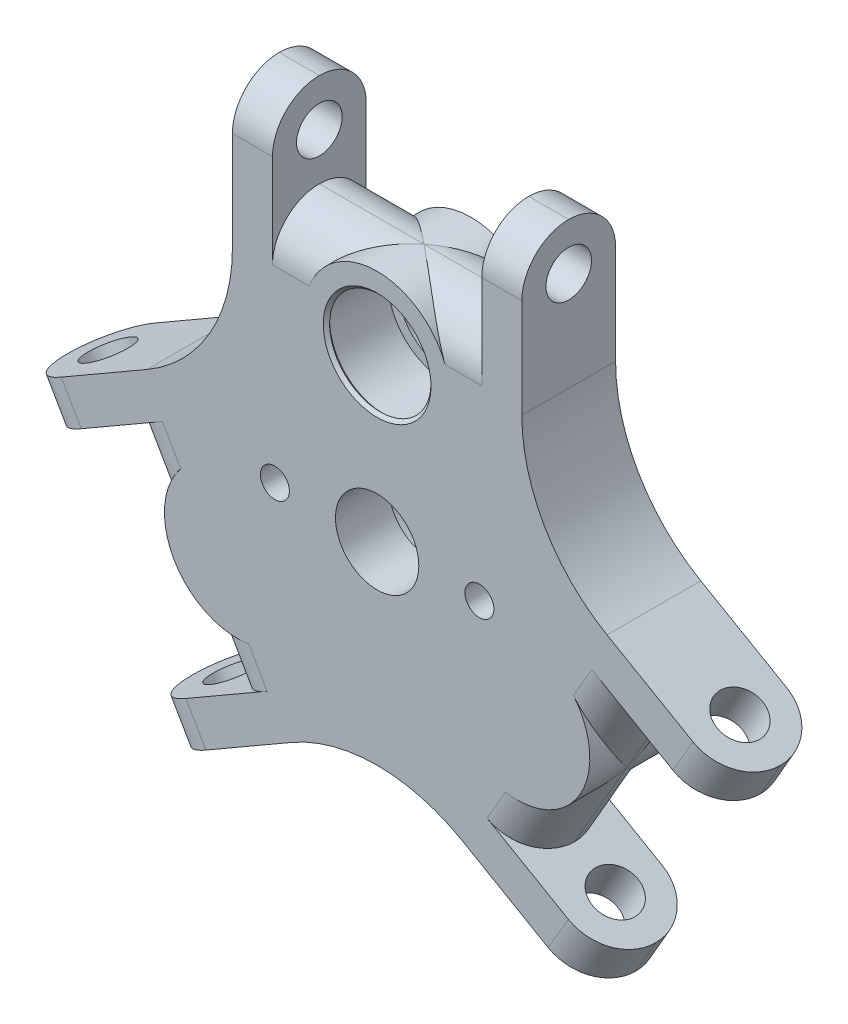
from build123d import *

# Parameters (mm, degrees)
SKETCH1_R           = 8.15
BOSS_EXTRUDE1_DEPTH = 11
FILLET1_R           = 5.5
SKETCH5_R           = 8.534526782
BOSS_EXTRUDE2_DEPTH = 11
SKETCH6_R           = 8.534526782
BOSS_EXTRUDE3_DEPTH = 11
SKETCH7_R           = 8.534526782
BOSS_EXTRUDE4_DEPTH = 11
SKETCH8_R           = 1.7
CUT_EXTRUDE4_DEPTH  = 58.906789501
BOSS_EXTRUDE5_START = -6.25
SKETCH12_R          = 8.15
BOSS_EXTRUDE5_DEPTH = 6.25
SKETCH14_R          = 4.8895
CUT_EXTRUDE7_DEPTH  = 58.906789501
SKETCH15_R          = 6.7
CUT_EXTRUDE8_DEPTH  = 8
SKETCH16_R          = 5.5
CUT_EXTRUDE9_DEPTH  = 58.412509697
SKETCH18_R          = 6.7
SKETCH18_R_2        = 5.95
BOSS_EXTRUDE6_DEPTH = 0.75
CHAMFER1_SIZE       = 0.375
CHAMFER2_SIZE       = 0.375
FILLET2_R           = 5.5
SKETCH19_R          = 2.675
CUT_EXTRUDE10_DEPTH = 72.149372656
SKETCH20_R          = 2.675
CUT_EXTRUDE11_DEPTH = 71.861300583
SKETCH21_R          = 2.675
CUT_EXTRUDE12_DEPTH = 75.055602664


with BuildPart() as part:
    # Sketch1 → Boss-Extrude1 (new body)
    with BuildSketch(Plane.XY):
        with BuildLine():
            Line((-16.980762114, 38.5), (-12.280762114, 38.5))
            Line((-12.280762114, 38.5), (-12.280762114, 27.5))
            Line((-12.280762114, 27.5), (12.280762114, 27.5))
            Line((12.280762114, 27.5), (12.280762114, 38.5))
            Line((12.280762114, 38.5), (16.980762114, 38.5))
            Line((16.980762114, 38.5), (16.980762114, 21.350852961))
            ThreePointArc((16.980762114, 21.350852961), (19.660254038, 11.350852961), (26.980762114, 4.030344885))
            Line((26.980762114, 4.030344885), (41.832359102, -4.544228634))
            Line((41.832359102, -4.544228634), (39.482359102, -8.614548032))
            Line((39.482359102, -8.614548032), (29.956079661, -3.114548032))
            Line((29.956079661, -3.114548032), (17.675317547, -24.385451968))
            Line((17.675317547, -24.385451968), (27.201596989, -29.885451968))
            Line((27.201596989, -29.885451968), (24.851596989, -33.955771366))
            Line((24.851596989, -33.955771366), (10, -25.381197846))
            ThreePointArc((10, -25.381197846), (0, -22.701705922), (-10, -25.381197846))
            Line((-10, -25.381197846), (-24.851596989, -33.955771366))
            Line((-24.851596989, -33.955771366), (-27.201596989, -29.885451968))
            Line((-27.201596989, -29.885451968), (-17.675317547, -24.385451968))
            Line((-17.675317547, -24.385451968), (-29.956079661, -3.114548032))
            Line((-29.956079661, -3.114548032), (-39.482359102, -8.614548032))
            Line((-39.482359102, -8.614548032), (-41.832359102, -4.544228634))
            Line((-41.832359102, -4.544228634), (-26.980762114, 4.030344885))
            ThreePointArc((-26.980762114, 4.030344885), (-19.660254038, 11.350852961), (-16.980762114, 21.350852961))
            Line((-16.980762114, 21.350852961), (-16.980762114, 38.5))
        make_face()
        Circle(SKETCH1_R, mode=Mode.SUBTRACT)
    extrude(amount=BOSS_EXTRUDE1_DEPTH)

    # Fillet1
    fillet1_edges = [part.edges().sort_by_distance(p)[0] for p in [
        (-23.815698604, -13.75, 0),
        (23.815698604, -13.75, 0),
        (23.815698604, -13.75, 11),
        (-23.815698604, -13.75, 11),
        (0, 27.5, 0),
        (0, 27.5, 11),
    ]]
    fillet(fillet1_edges, radius=FILLET1_R - 0.0001)  # a hair under: the kernel refuses the full size

    # Sketch5 → Boss-Extrude2 (add)
    with BuildSketch(Plane(origin=(0, 0, 0), x_dir=(-1, 0, 0), z_dir=(0, 0, -1))):
        with Locations((0, 18.965473218)):
            Circle(SKETCH5_R)
    extrude(amount=-BOSS_EXTRUDE2_DEPTH)

    # Sketch6 → Boss-Extrude3 (add)
    with BuildSketch(Plane(origin=(0, 0, 0), x_dir=(-1, 0, 0), z_dir=(0, 0, -1))):
        with Locations((-16.424581602, -9.482736609)):
            Circle(SKETCH6_R)
    extrude(amount=-BOSS_EXTRUDE3_DEPTH)

    # Sketch7 → Boss-Extrude4 (add)
    with BuildSketch(Plane.XY.offset(11)):
        with Locations((-16.424581602, -9.482736609)):
            Circle(SKETCH7_R)
    extrude(amount=-BOSS_EXTRUDE4_DEPTH)

    # Sketch8 → Cut-Extrude4 (cut, through all)
    with BuildSketch(Plane.XY.offset(11)):
        with Locations((-12, 0)):
            Circle(SKETCH8_R)
        with Locations((12, 0)):
            Circle(SKETCH8_R)
    extrude(amount=-CUT_EXTRUDE4_DEPTH, mode=Mode.SUBTRACT)

    # Sketch12 → Boss-Extrude5 (add)
    with BuildSketch(Plane.XY.offset(11).offset(BOSS_EXTRUDE5_START)):
        Circle(SKETCH12_R)
    extrude(amount=BOSS_EXTRUDE5_DEPTH)

    # Sketch14 → Cut-Extrude7 (cut, through all)
    with BuildSketch(Plane.XY.offset(11)):
        Circle(SKETCH14_R)
    extrude(amount=-CUT_EXTRUDE7_DEPTH, mode=Mode.SUBTRACT)

    # Sketch15 → Cut-Extrude8 (cut)
    with BuildSketch(Plane.XY.offset(11)):
        with Locations((0, 18.965473218)):
            Circle(SKETCH15_R)
    extrude(amount=-CUT_EXTRUDE8_DEPTH, mode=Mode.SUBTRACT)

    # Sketch16 → Cut-Extrude9 (cut, through all)
    with BuildSketch(Plane.XY.offset(3)):
        with Locations((0, 18.965473218)):
            Circle(SKETCH16_R)
    extrude(amount=-CUT_EXTRUDE9_DEPTH, mode=Mode.SUBTRACT)

    # Sketch18 → Boss-Extrude6 (add)
    with BuildSketch(Plane.XY.offset(11)):
        with Locations((0, 18.965473218)):
            Circle(SKETCH18_R)
        with Locations((0, 18.965473218)):
            Circle(SKETCH18_R_2, mode=Mode.SUBTRACT)
    extrude(amount=-BOSS_EXTRUDE6_DEPTH)

    # Chamfer1
    chamfer1_edges = [part.edges().sort_by_distance(p)[0] for p in [
        (-5.95, 18.965473218, 11),
    ]]
    chamfer(chamfer1_edges, length=CHAMFER1_SIZE)

    # Chamfer2
    chamfer2_edges = [part.edges().sort_by_distance(p)[0] for p in [
        (-5.95, 18.965473218, 10.25),
    ]]
    chamfer(chamfer2_edges, length=CHAMFER2_SIZE - 0.0001)  # a hair under: the kernel refuses the full size

    # Fillet2
    fillet2_edges = [part.edges().sort_by_distance(p)[0] for p in [
        (26.026596989, -31.920611667, 0),
        (40.657359102, -6.579388333, 0),
        (26.026596989, -31.920611667, 11),
        (40.657359102, -6.579388333, 11),
        (14.630762114, 38.5, 0),
        (14.630762114, 38.5, 11),
        (-40.657359102, -6.579388333, 0),
        (-40.657359102, -6.579388333, 11),
        (-26.026596989, -31.920611667, 0),
        (-26.026596989, -31.920611667, 11),
        (-14.630762114, 38.5, 0),
        (-14.630762114, 38.5, 11),
    ]]
    fillet(fillet2_edges, radius=FILLET2_R - 0.0001)  # a hair under: the kernel refuses the full size

    # Sketch19 → Cut-Extrude10 (cut, through all)
    with BuildSketch(Plane.ZY.offset(16.980762114)):
        with Locations(Location((5.5, 33, 0), (0, 0, 270))):
            Circle(SKETCH19_R)
    extrude(amount=-CUT_EXTRUDE10_DEPTH, mode=Mode.SUBTRACT)

    # Sketch20 → Cut-Extrude11 (cut, through all)
    with BuildSketch(Plane(origin=(-8.490381057, 14.705771366, 0), x_dir=(0.8660254037844307, 0.5000000000000139, 0), z_dir=(-0.5000000000000139, 0.8660254037844307, 0))):
        with Locations((-33, -5.5)):
            Circle(SKETCH20_R)
    extrude(amount=-CUT_EXTRUDE11_DEPTH, mode=Mode.SUBTRACT)

    # Sketch21 → Cut-Extrude12 (cut, through all)
    with BuildSketch(Plane(origin=(-8.490381057, -14.705771366, 0), x_dir=(0.8660254037844329, -0.50000000000001, 0), z_dir=(-0.5000000000000099, -0.8660254037844328, 0))):
        with Locations(Location((33, 5.5, 0), (0, 0, 180))):
            Circle(SKETCH21_R)
    extrude(amount=-CUT_EXTRUDE12_DEPTH, mode=Mode.SUBTRACT)


solid = part.part
